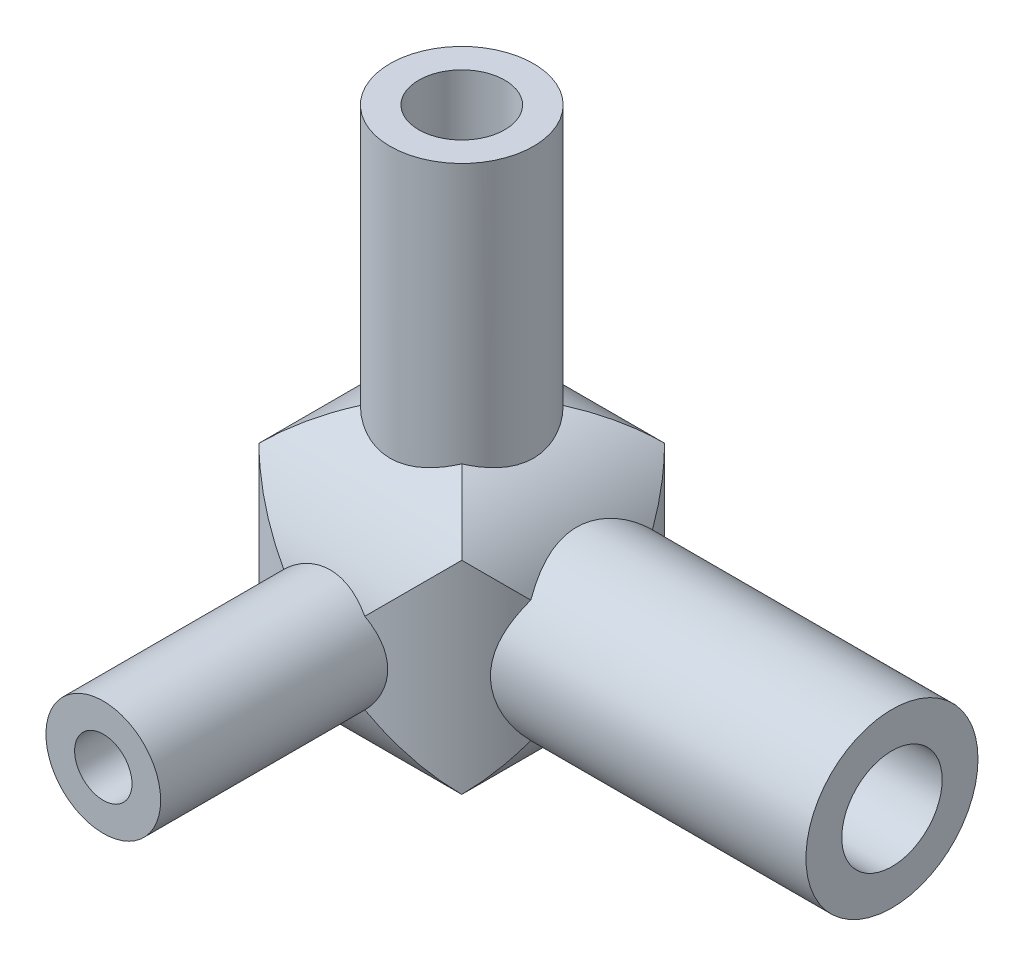
from build123d import *

# Parameters (mm, degrees)
EXTRUDE_START       = -100
EXTRUDE_1_OUTLINE_R = 20
EXTRUDE_1_DEPTH     = 200
SKETCH_3_W          = 400
SKETCH_3_H          = 400
SKETCH_3_R          = 20
CUT_EXTRUDE_1_DEPTH = 201
SKETCH_4_W          = 400
SKETCH_4_H          = 400
SKETCH_4_R          = 20
CUT_EXTRUDE_2_DEPTH = 41
SKETCH_5_R          = 12
EXTRUDE_2_DEPTH     = 60
SKETCH_6_R          = 10
EXTRUDE_3_DEPTH     = 55
SKETCH_7_R          = 8
EXTRUDE_4_DEPTH     = 50
SWEEP_2_PROFILE_R   = 6
SKETCH_10_R         = 7
CUT_EXTRUDE_3_DEPTH = 65
SKETCH_11_R         = 6
CUT_EXTRUDE_4_DEPTH = 61
SKETCH_12_R         = 4
CUT_EXTRUDE_5_DEPTH = 55


# Read off the part's stored shape, not the designer's step: 凸台-拉伸1
with BuildPart() as part:
    # 凸台-拉伸1 outline → 凸台-拉伸1 (new body)
    with BuildSketch(Plane(origin=(0, 0, 0), x_dir=(0, 0, -1), z_dir=(1, 0, 0)).offset(EXTRUDE_START)):
        Circle(EXTRUDE_1_OUTLINE_R)
    extrude(amount=EXTRUDE_1_DEPTH)

    # 草图3 → 切除-拉伸1 (cut, symmetric)
    with BuildSketch(Plane(origin=(0, 0, 0), x_dir=(1, 0, 0), z_dir=(0, 1, 0))):
        Rectangle(SKETCH_3_W, SKETCH_3_H)
        Circle(SKETCH_3_R, mode=Mode.SUBTRACT)
    extrude(amount=CUT_EXTRUDE_1_DEPTH, both=True, mode=Mode.SUBTRACT)

    # 草图4 → 切除-拉伸2 (cut, symmetric)
    with BuildSketch(Plane.XY):
        Rectangle(SKETCH_4_W, SKETCH_4_H)
        Circle(SKETCH_4_R, mode=Mode.SUBTRACT)
    extrude(amount=CUT_EXTRUDE_2_DEPTH, both=True, mode=Mode.SUBTRACT)

    # 草图5 → 凸台-拉伸2 (add)
    with BuildSketch(Plane(origin=(0, 0, 0), x_dir=(0, 0, -1), z_dir=(1, 0, 0))):
        with Locations(Location((0, 0, 0), (0, 0, 135.000000087))):
            Circle(SKETCH_5_R)
    extrude(amount=EXTRUDE_2_DEPTH)

    # 草图6 → 凸台-拉伸3 (add)
    with BuildSketch(Plane(origin=(0, 0, 0), x_dir=(1, 0, 0), z_dir=(0, 1, 0))):
        with Locations(Location((0, 0, 0), (0, 0, 44.999999998))):
            Circle(SKETCH_6_R)
    extrude(amount=EXTRUDE_3_DEPTH)

    # 草图7 → 凸台-拉伸4 (add)
    with BuildSketch(Plane.XY):
        with Locations(Location((0, 0, 0), (0, 0, 134.99999999))):
            Circle(SKETCH_7_R)
    extrude(amount=EXTRUDE_4_DEPTH)

    # 扫描2: sweep along a curve in space
    with BuildLine() as sweep_2_path:
        Line((0, 0, 0), (-28.867513, -28.867513, -28.867513))
    # 扫描2 profile (on start of the path) → 扫描2 (sweep)
    with BuildSketch(Plane(origin=(0, 0, 0), x_dir=(-0.7071067811865476, 0, 0.7071067811865476), z_dir=(-0.5773502691896257, -0.5773502691896257, -0.5773502691896257))):
        Circle(SWEEP_2_PROFILE_R)
    sweep(path=sweep_2_path.line)

    # 草图9 → 旋转2 (revolve)
    with BuildSketch(Plane(origin=(-28.867513, 0, 0), x_dir=(0, 0, -1), z_dir=(1, 0, 0))):
        with BuildLine():
            Line((22.867513, -28.867513), (34.867513, -28.867513))
            ThreePointArc((34.867513, -28.867513), (28.867513, -22.867513), (22.867513, -28.867513))
        make_face()
    revolve(axis=Axis((-28.867513, -28.867513, -34.867513), (0, 0, 1)))

    # 草图10 → 切除-拉伸3 (cut)
    with BuildSketch(Plane(origin=(60, 0, 0), x_dir=(0, 0, -1), z_dir=(1, 0, 0))):
        Circle(SKETCH_10_R)
    extrude(amount=-CUT_EXTRUDE_3_DEPTH, mode=Mode.SUBTRACT)

    # 草图11 → 切除-拉伸4 (cut)
    with BuildSketch(Plane(origin=(0, 60, 0), x_dir=(1, 0, 0), z_dir=(0, 1, 0))):
        with Locations(Location((0, 0, 0), (0, 0, 270))):
            Circle(SKETCH_11_R)
    extrude(amount=-CUT_EXTRUDE_4_DEPTH, mode=Mode.SUBTRACT)

    # 草图12 → 切除-拉伸5 (cut)
    with BuildSketch(Plane.XY.offset(50)):
        Circle(SKETCH_12_R)
    extrude(amount=-CUT_EXTRUDE_5_DEPTH, mode=Mode.SUBTRACT)


solid = part.part
